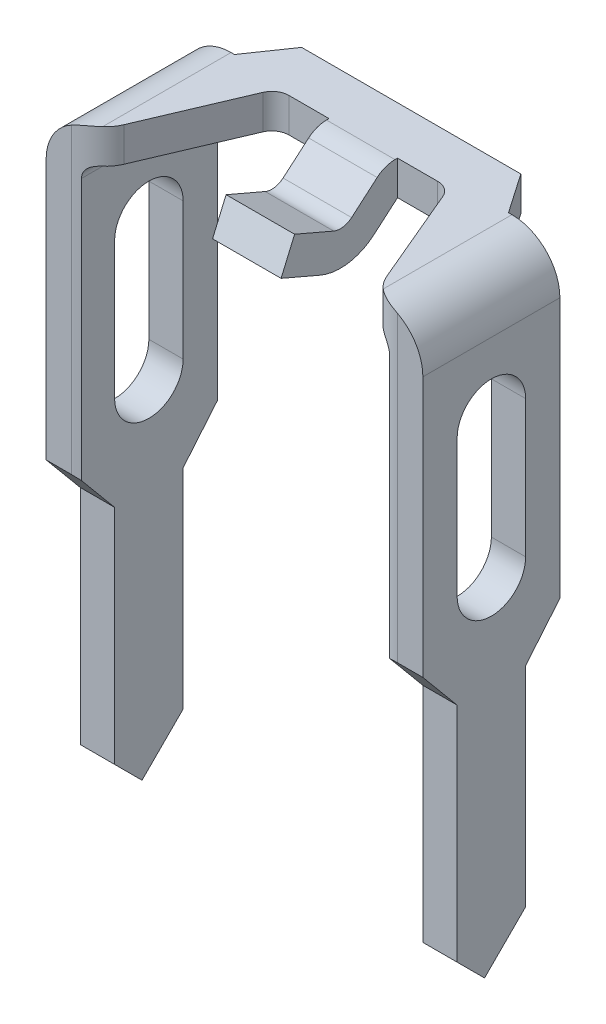
from build123d import *

# Parameters (mm, degrees)
BOSS_EXTRUDE1_DEPTH = 2.58
CUT_EXTRUDE1_DEPTH  = 10.5
CUT_EXTRUDE2_DEPTH  = 5.25
BOSS_EXTRUDE2_DEPTH = 0.5
CHAMFER1_SIZE       = 0.6
CHAMFER2_SIZE       = 0.4


with BuildPart() as part:
    # Sketch1 → Boss-Extrude1 (new body)
    with BuildSketch(Plane.XY):
        with BuildLine():
            Line((-2.75, -4), (-2.75, 4.05))
            ThreePointArc((-2.75, 4.05), (-2.544974747, 4.544974747), (-2.05, 4.75))
            Line((-2.05, 4.75), (2.05, 4.75))
            ThreePointArc((2.05, 4.75), (2.544974747, 4.544974747), (2.75, 4.05))
            Line((2.75, 4.05), (2.75, -4))
            Line((2.75, -4), (2.25, -4))
            Line((2.25, -4), (2.25, 4.05))
            ThreePointArc((2.25, 4.05), (2.191421356, 4.191421356), (2.05, 4.25))
            Line((2.05, 4.25), (-2.05, 4.25))
            ThreePointArc((-2.05, 4.25), (-2.191421356, 4.191421356), (-2.25, 4.05))
            Line((-2.25, 4.05), (-2.25, -4))
            Line((-2.25, -4), (-2.75, -4))
        make_face()
    extrude(amount=BOSS_EXTRUDE1_DEPTH)

    # Sketch2 → Cut-Extrude1 (cut)
    with BuildSketch(Plane(origin=(0, 4.75, 0), x_dir=(1, 0, 0), z_dir=(0, 1, 0))):
        Polygon((-2, -0.58), (-4.099439411, -0.58), (-4.099439411, 0.833357165), (-2, 0.833357165), (-1.6, 0), align=None)
        Polygon((2, -0.58), (3.357409655, -0.58), (3.357409655, 0.833357165), (2, 0.833357165), (1.6, 0), align=None)
        with BuildLine():
            Line((-2.75, -2.58), (-2.38062097, -2.58))
            ThreePointArc((-2.38062097, -2.58), (-2.104839164, -2.497066416), (-1.920543652, -2.275777582))
            Line((-1.920543652, -2.275777582), (-1.314728174, -0.852111209))
            ThreePointArc((-1.314728174, -0.852111209), (-1.222580418, -0.741466792), (-1.084689515, -0.7))
            Line((-1.084689515, -0.7), (1.084290526, -0.7))
            ThreePointArc((1.084290526, -0.7), (1.222412736, -0.741619926), (1.314545856, -0.852621958))
            Line((1.314545856, -0.852621958), (1.915985292, -2.274756083))
            ThreePointArc((1.915985292, -2.274756083), (2.100251533, -2.496760148), (2.376495952, -2.58))
            Line((2.376495952, -2.58), (2.75, -2.58))
            Line((2.75, -2.58), (2.75, -3.056093585))
            Line((2.75, -3.056093585), (-2.75, -3.056093585))
            Line((-2.75, -3.056093585), (-2.75, -2.58))
        make_face()
    extrude(amount=-CUT_EXTRUDE1_DEPTH, mode=Mode.SUBTRACT)

    # Sketch3 → Cut-Extrude2 (cut, symmetric)
    with BuildSketch(Plane(origin=(0, 0, 0), x_dir=(0, 0, -1), z_dir=(1, 0, 0))):
        Polygon((-0.58, 0.25), (-1.08, -0.35), (-1.08, -4.396314828), (-0.130305992, -4.396314828), (-0.130305992, 0.25), align=None)
        Polygon((-2.58, 0.25), (-2.08, -0.35), (-2.08, -4.896314828), (-3.070294312, -4.896314828), (-3.070294312, 0.25), align=None)
        with BuildLine():
            Line((-1.08, 3.024565065), (-1.08, 1.024565065))
            ThreePointArc((-1.08, 1.024565065), (-1.58, 0.524565065), (-2.08, 1.024565065))
            Line((-2.08, 1.024565065), (-2.08, 3.024565065))
            ThreePointArc((-2.08, 3.024565065), (-1.58, 3.524565065), (-1.08, 3.024565065))
        make_face()
    extrude(amount=CUT_EXTRUDE2_DEPTH, both=True, mode=Mode.SUBTRACT)

    # Sketch4 → Boss-Extrude2 (add, symmetric)
    with BuildSketch(Plane(origin=(0, 0, 0), x_dir=(0, 0, -1), z_dir=(1, 0, 0))):
        with BuildLine():
            Line((-0.7, 4.25), (-1.045169213, 3.954140675))
            ThreePointArc((-1.045169213, 3.954140675), (-1.420160684, 3.782160221), (-1.829373497, 3.834512432))
            Line((-1.829373497, 3.834512432), (-2.4, 4.079724782))
            Line((-2.4, 4.079724782), (-2.202592831, 4.539105245))
            Line((-2.202592831, 4.539105245), (-1.631966328, 4.293892895))
            ThreePointArc((-1.631966328, 4.293892895), (-1.495562057, 4.276442158), (-1.3705649, 4.333768976))
            Line((-1.3705649, 4.333768976), (-0.997308957, 4.653702641))
            ThreePointArc((-0.997308957, 4.653702641), (-0.875770907, 4.725154006), (-0.736992408, 4.75))
            Line((-0.736992408, 4.75), (-0.7, 4.75))
            Line((-0.7, 4.75), (-0.7, 4.25))
        make_face()
    extrude(amount=BOSS_EXTRUDE2_DEPTH, both=True)

    # Chamfer1
    chamfer1_edges = [part.edges().sort_by_distance(p)[0] for p in [
        (2.5, -4, 1.08),
        (-2.5, -4, 1.08),
    ]]
    chamfer(chamfer1_edges, length=CHAMFER1_SIZE)

    # Chamfer2
    chamfer2_edges = [part.edges().sort_by_distance(p)[0] for p in [
        (-2.5, -4, 2.08),
        (2.5, -4, 2.08),
    ]]
    chamfer(chamfer2_edges, length=CHAMFER2_SIZE - 0.0001)  # a hair under: the kernel refuses the full size


solid = part.part
